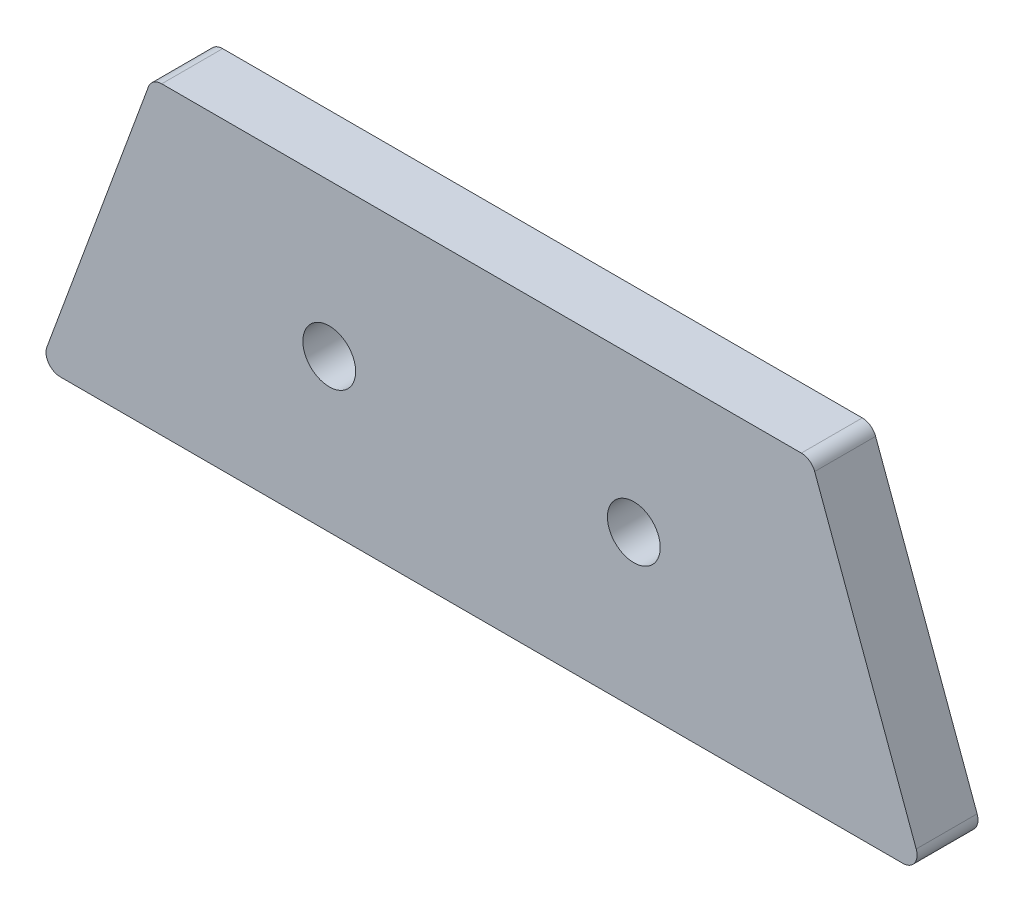
from build123d import *

# Parameters (mm, degrees)
SKETCH2_R           = 3.302
BOSS_EXTRUDE1_DEPTH = 7.62


with BuildPart() as part:
    # Sketch2 → Boss-Extrude1 (new body)
    with BuildSketch(Plane.XY):
        with BuildLine():
            Line((40.005, 34.194483756), (-40.005, 34.194483756))
            ThreePointArc((-40.005, 34.194483756), (-41.022456018, 33.874587748), (-41.673792668, 33.030010472))
            Line((-41.673792668, 33.030010472), (-54.373792668, -1.513989528))
            ThreePointArc((-54.373792668, -1.513989528), (-54.163103992, -3.144972262), (-52.705, -3.905516244))
            Line((-52.705, -3.905516244), (52.705, -3.905516244))
            ThreePointArc((52.705, -3.905516244), (54.163103992, -3.144972262), (54.373792668, -1.513989528))
            Line((54.373792668, -1.513989528), (41.673792668, 33.030010472))
            ThreePointArc((41.673792668, 33.030010472), (41.022456018, 33.874587748), (40.005, 34.194483756))
        make_face()
        with Locations((-19.05, 15.144483756)):
            Circle(SKETCH2_R, mode=Mode.SUBTRACT)
        with Locations((19.05, 15.144483756)):
            Circle(SKETCH2_R, mode=Mode.SUBTRACT)
    extrude(amount=BOSS_EXTRUDE1_DEPTH)


solid = part.part
